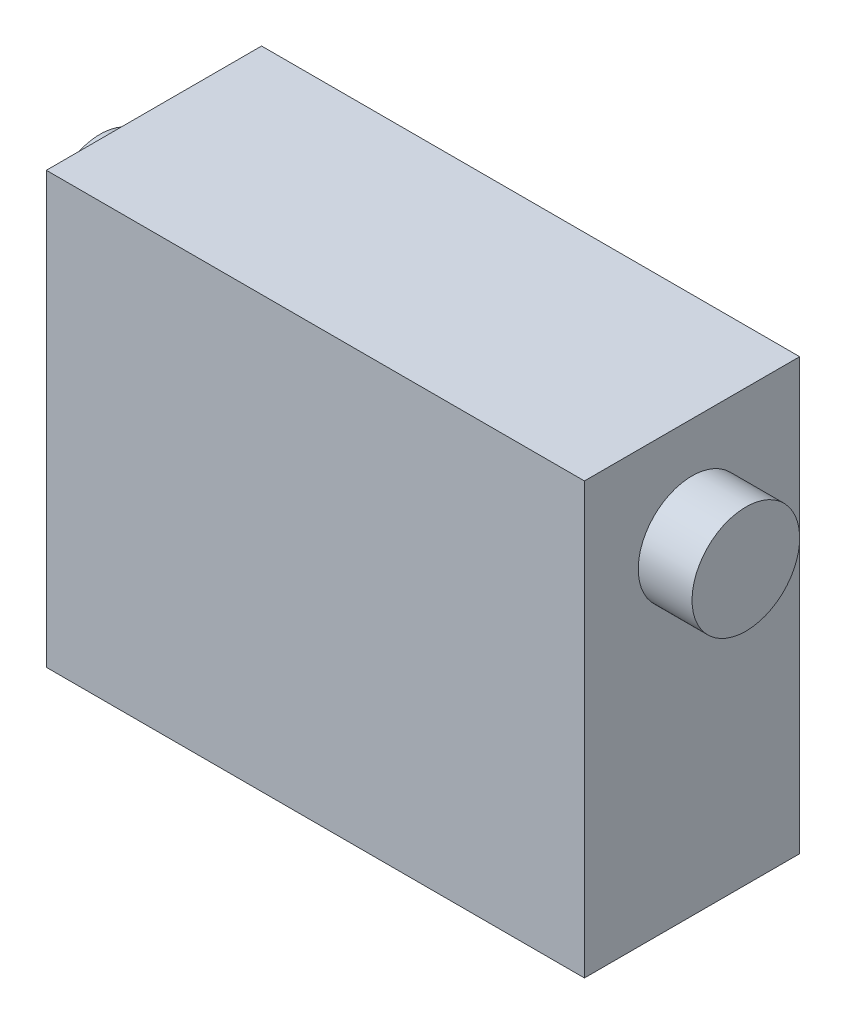
from build123d import *

# Parameters (mm, degrees)
SKETCH1_W                = 50
SKETCH1_H                = 40
BOSS_EXTRUDE1_DEPTH      = 20
BOSS_EXTRUDE2_DEPTH      = 5
BOSS_EXTRUDE2_DEPTH_BACK = 55
SKETCH2_R                = 5


with BuildPart() as part:
    # Sketch1 → Boss-Extrude1 (new body)
    with BuildSketch(Plane.XY):
        Rectangle(SKETCH1_W, SKETCH1_H)
    extrude(amount=BOSS_EXTRUDE1_DEPTH)

    # Sketch2 → Boss-Extrude2 (add, two sides: drawn at the far end of the back side and taken through both)
    with BuildSketch(Plane.ZY.offset(25).offset(-BOSS_EXTRUDE2_DEPTH_BACK)):
        with Locations((10, 10.407747154)):
            Circle(SKETCH2_R)
    extrude(amount=BOSS_EXTRUDE2_DEPTH + BOSS_EXTRUDE2_DEPTH_BACK)


solid = part.part
